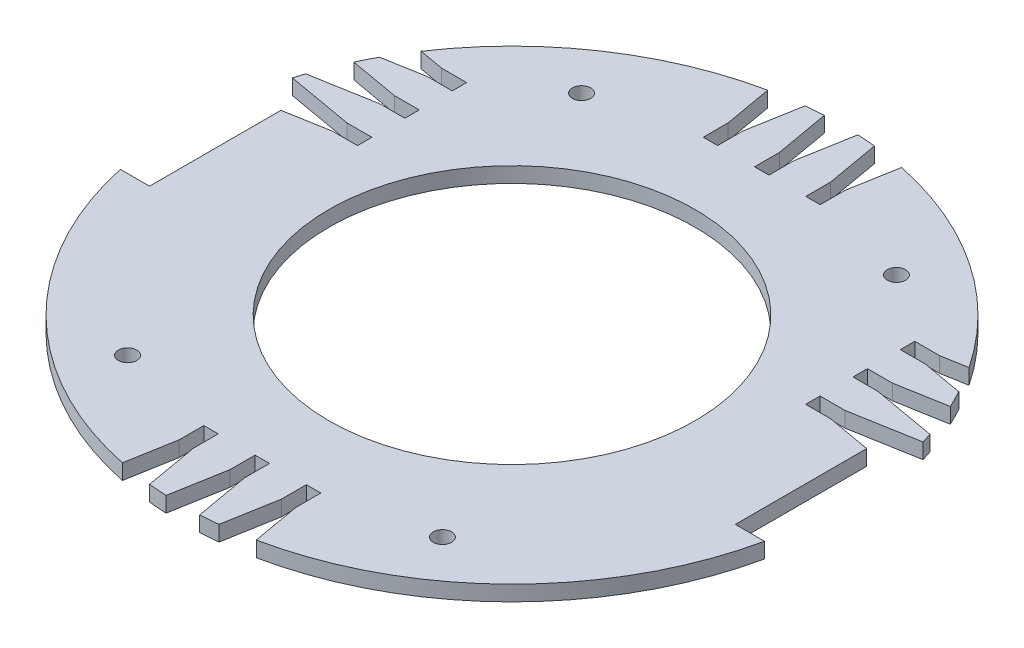
from build123d import *

# Parameters (mm, degrees)
SKETCH1_R            = 114.3
BASE_DEPTH           = 5.334
SKETCH2_R            = 63.5
CENTER_CUT_DEPTH     = 162.732592745
SENSOR_CUTOUTS_DEPTH = 162.732592745
SKETCH7_W            = 30.48
SKETCH7_H            = 48.26
CUT_EXTRUDE2_DEPTH   = 162.891213524
HOLE3_OUTLINE_R      = 3.175
HOLE3_DEPTH          = 5.334


# Read off the part's stored shape, not the designer's step: Hole3
with BuildPart() as part:
    # Sketch1 → Base (new body)
    with BuildSketch(Plane(origin=(0, 0, 0), x_dir=(1, 0, 0), z_dir=(0, 1, 0))):
        with Locations(Location((0, 0, 0), (0, 0, 270))):
            Circle(SKETCH1_R)
    extrude(amount=BASE_DEPTH)

    # Sketch2 → Center Cut (cut, through all)
    with BuildSketch(Plane(origin=(0, 5.334, 0), x_dir=(1, 0, 0), z_dir=(0, 1, 0))):
        with Locations(Location((0, 0, 0), (0, 0, 270))):
            Circle(SKETCH2_R)
    extrude(amount=-CENTER_CUT_DEPTH, mode=Mode.SUBTRACT)

    # Sketch3 → Sensor Cutouts (cut, through all)
    with BuildSketch(Plane(origin=(0, 5.334, 0), x_dir=(1, 0, 0), z_dir=(0, 1, 0))):
        with BuildLine():
            Line((5.832770158, 114.151078805), (2.5, 95.25))
            Line((2.5, 95.25), (2.5, 86.614))
            Line((2.5, 86.614), (-2.5, 86.614))
            Line((-2.5, 86.614), (-2.5, 95.25))
            Line((-2.5, 95.25), (-5.832770158, 114.151078805))
            ThreePointArc((-5.832770158, 114.151078805), (0, 114.3), (5.832770158, 114.151078805))
        make_face()
        with BuildLine():
            Line((20.28, 95.25), (23.218811767, 111.916829745))
            ThreePointArc((23.218811767, 111.916829745), (17.647544886, 112.929421142), (12.032965395, 113.664848321))
            Line((12.032965395, 113.664848321), (15.28, 95.25))
            Line((15.28, 95.25), (15.28, 86.614))
            Line((15.28, 86.614), (20.28, 86.614))
            Line((20.28, 86.614), (20.28, 95.25))
        make_face()
        with BuildLine():
            Line((-20.28, 95.25), (-23.218811767, 111.916829745))
            ThreePointArc((-23.218811767, 111.916829745), (-17.647544886, 112.929421142), (-12.032965395, 113.664848321))
            Line((-12.032965395, 113.664848321), (-15.28, 95.25))
            Line((-15.28, 95.25), (-15.28, 86.614))
            Line((-15.28, 86.614), (-20.28, 86.614))
            Line((-20.28, 86.614), (-20.28, 95.25))
        make_face()
        Polygon((86.36, 45.56), (114.3, 50.486575841), (114.3, 35.633424159), (86.36, 40.56), (77.724, 40.56), (77.724, 45.56), align=None)
        Polygon((86.36, 61.99), (114.3, 66.916575841), (114.3, 52.063424159), (86.36, 56.99), (77.724, 56.99), (77.724, 61.99), align=None)
        Polygon((86.36, 29.13), (114.3, 34.056575841), (114.3, 19.203424159), (86.36, 24.13), (77.724, 24.13), (77.724, 29.13), align=None)
        with BuildLine():
            Line((15.28, -95.25), (15.28, -86.614))
            Line((15.28, -86.614), (20.28, -86.614))
            Line((20.28, -86.614), (20.28, -95.25))
            Line((20.28, -95.25), (23.218811767, -111.916829745))
            ThreePointArc((23.218811767, -111.916829745), (17.647544886, -112.929421142), (12.032965395, -113.664848321))
            Line((12.032965395, -113.664848321), (15.28, -95.25))
        make_face()
        with BuildLine():
            Line((2.5, -86.614), (2.5, -95.25))
            Line((2.5, -95.25), (5.832770158, -114.151078805))
            ThreePointArc((5.832770158, -114.151078805), (0, -114.3), (-5.832770158, -114.151078805))
            Line((-5.832770158, -114.151078805), (-2.5, -95.25))
            Line((-2.5, -95.25), (-2.5, -86.614))
            Line((-2.5, -86.614), (2.5, -86.614))
        make_face()
        with BuildLine():
            Line((-15.28, -86.614), (-15.28, -95.25))
            Line((-15.28, -95.25), (-12.032965395, -113.664848321))
            ThreePointArc((-12.032965395, -113.664848321), (-17.647544886, -112.929421142), (-23.218811767, -111.916829745))
            Line((-23.218811767, -111.916829745), (-20.28, -95.25))
            Line((-20.28, -95.25), (-20.28, -86.614))
            Line((-20.28, -86.614), (-15.28, -86.614))
        make_face()
        Polygon((-77.724, 24.13), (-86.36, 24.13), (-114.3, 19.203424159), (-114.3, 34.056575841), (-86.36, 29.13), (-77.724, 29.13), align=None)
        Polygon((-77.724, 40.56), (-86.36, 40.56), (-114.3, 35.633424159), (-114.3, 50.486575841), (-86.36, 45.56), (-77.724, 45.56), align=None)
        Polygon((-77.724, 56.99), (-86.36, 56.99), (-114.3, 52.063424159), (-114.3, 66.916575841), (-86.36, 61.99), (-77.724, 61.99), align=None)
    extrude(amount=-SENSOR_CUTOUTS_DEPTH, mode=Mode.SUBTRACT)

    # Sketch7 → Cut-Extrude2 (cut, through all)
    with BuildSketch(Plane.XZ.offset(5.334)):
        with Locations((-116.84, 0)):
            Rectangle(SKETCH7_W, SKETCH7_H)
        with Locations((116.84, 0)):
            Rectangle(SKETCH7_W, SKETCH7_H)
    extrude(amount=-CUT_EXTRUDE2_DEPTH, mode=Mode.SUBTRACT)

    # Hole3 outline → Hole3 (cut)
    with BuildSketch(Plane(origin=(0, 0, 0), x_dir=(1, 0, 0), z_dir=(0, 1, 0))):
        with Locations((-54.61, -78.74)):
            Circle(HOLE3_OUTLINE_R)
        with Locations((54.61, -78.74)):
            Circle(HOLE3_OUTLINE_R)
        with Locations((54.61, 78.74)):
            Circle(HOLE3_OUTLINE_R)
        with Locations((-54.61, 78.74)):
            Circle(HOLE3_OUTLINE_R)
    extrude(amount=HOLE3_DEPTH, mode=Mode.SUBTRACT)


solid = part.part
